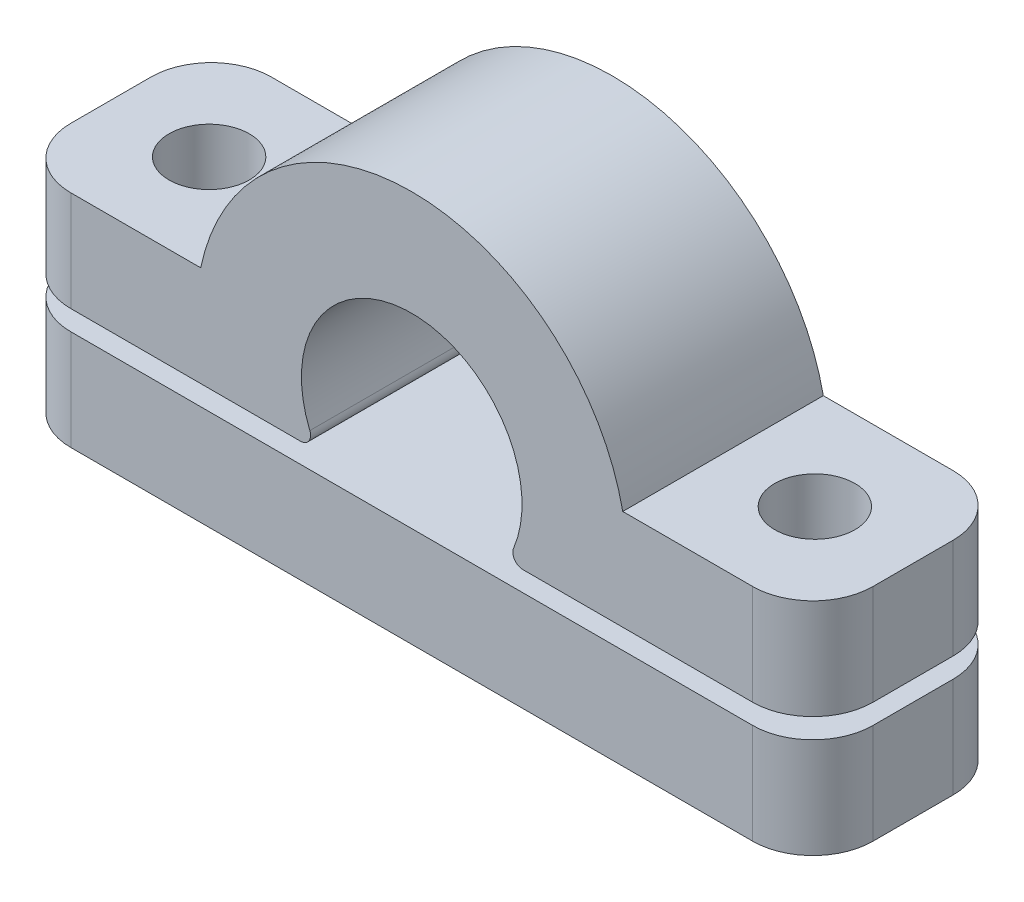
from build123d import *

# Parameters (mm, degrees)
BOSS_EXTRUDE1_START      = -1
SKETCH1_W                = 40
SKETCH1_H                = 10
BOSS_EXTRUDE1_DEPTH      = 5
BOSS_EXTRUDE2_DEPTH      = 5
BOSS_EXTRUDE2_DEPTH_BACK = 5
SKETCH3_W                = 10
SKETCH3_H                = 10
BOSS_EXTRUDE3_DEPTH      = 5
FILLET1_R                = 3
FILLET2_R                = 3
FILLET3_R                = 0.5
CUT_EXTRUDE1_DEPTH       = 25.669870287
CUT_EXTRUDE1_DEPTH_BACK  = 25.669870287
SKETCH4_R                = 2


with BuildPart() as part:
    # Sketch1 → Boss-Extrude1 (new body)
    with BuildSketch(Plane(origin=(0, 0, 0), x_dir=(1, 0, 0), z_dir=(0, 1, 0)).offset(BOSS_EXTRUDE1_START)):
        Rectangle(SKETCH1_W, SKETCH1_H)
    extrude(amount=-BOSS_EXTRUDE1_DEPTH)

    # Fillet2
    fillet2_edges = [part.edges().sort_by_distance(p)[0] for p in [
        (-20, -3.5, 5),
        (-20, -3.5, -5),
        (20, -3.5, 5),
        (20, -3.5, -5),
    ]]
    fillet(fillet2_edges, radius=FILLET2_R)


with BuildPart() as body_2:
    # Sketch2 → Boss-Extrude2 (new, two sides: drawn at the far end of the back side and taken through both)
    with BuildSketch(Plane.XY.offset(-BOSS_EXTRUDE2_DEPTH_BACK)):
        with BuildLine():
            Line((-10.378945033, 0), (-4.733920151, 0))
            ThreePointArc((-4.733920151, 0), (0, 8.3), (4.733920151, 0))
            Line((4.733920151, 0), (10.378945033, 0))
            ThreePointArc((10.378945033, 0), (0, 13.55), (-10.378945033, 0))
        make_face()
    extrude(amount=BOSS_EXTRUDE2_DEPTH + BOSS_EXTRUDE2_DEPTH_BACK)

    # Sketch3 → Boss-Extrude3 (add)
    with BuildSketch(Plane(origin=(0, 0, 0), x_dir=(1, 0, 0), z_dir=(0, 1, 0))):
        with Locations((-15, 0)):
            Rectangle(SKETCH3_W, SKETCH3_H)
        with Locations((15, 0)):
            Rectangle(SKETCH3_W, SKETCH3_H)
    extrude(amount=BOSS_EXTRUDE3_DEPTH)

    # Fillet1
    fillet1_edges = [body_2.edges().sort_by_distance(p)[0] for p in [
        (20, 2.5, -5),
        (20, 2.5, 5),
        (-20, 2.5, -5),
        (-20, 2.5, 5),
    ]]
    fillet(fillet1_edges, radius=FILLET1_R)

    # Fillet3
    fillet3_edges = [body_2.edges().sort_by_distance(p)[0] for p in [
        (-4.733920151, 0, 0),
        (4.733920151, 0, 0),
    ]]
    fillet(fillet3_edges, radius=FILLET3_R)


with BuildPart() as cut_extrude1_tool:
    # Sketch4 → Cut-Extrude1 (new, two sides: drawn at the far end of the back side and taken through both)
    with BuildSketch(Plane(origin=(0, 0, 0), x_dir=(1, 0, 0), z_dir=(0, 1, 0)).offset(-CUT_EXTRUDE1_DEPTH_BACK)):
        with Locations((-15.1, 0)):
            Circle(SKETCH4_R)
        with Locations((15.1, 0)):
            Circle(SKETCH4_R)
    extrude(amount=CUT_EXTRUDE1_DEPTH + CUT_EXTRUDE1_DEPTH_BACK)


with BuildPart() as part_1:
    add(part.part)

    # Cut-Extrude1: cut by cut_extrude1_tool
    add(cut_extrude1_tool.part, mode=Mode.SUBTRACT)


with BuildPart() as body_2_1:
    add(body_2.part)

    # Cut-Extrude1: cut by cut_extrude1_tool
    add(cut_extrude1_tool.part, mode=Mode.SUBTRACT)


solid = Compound([part_1.part, body_2_1.part])
